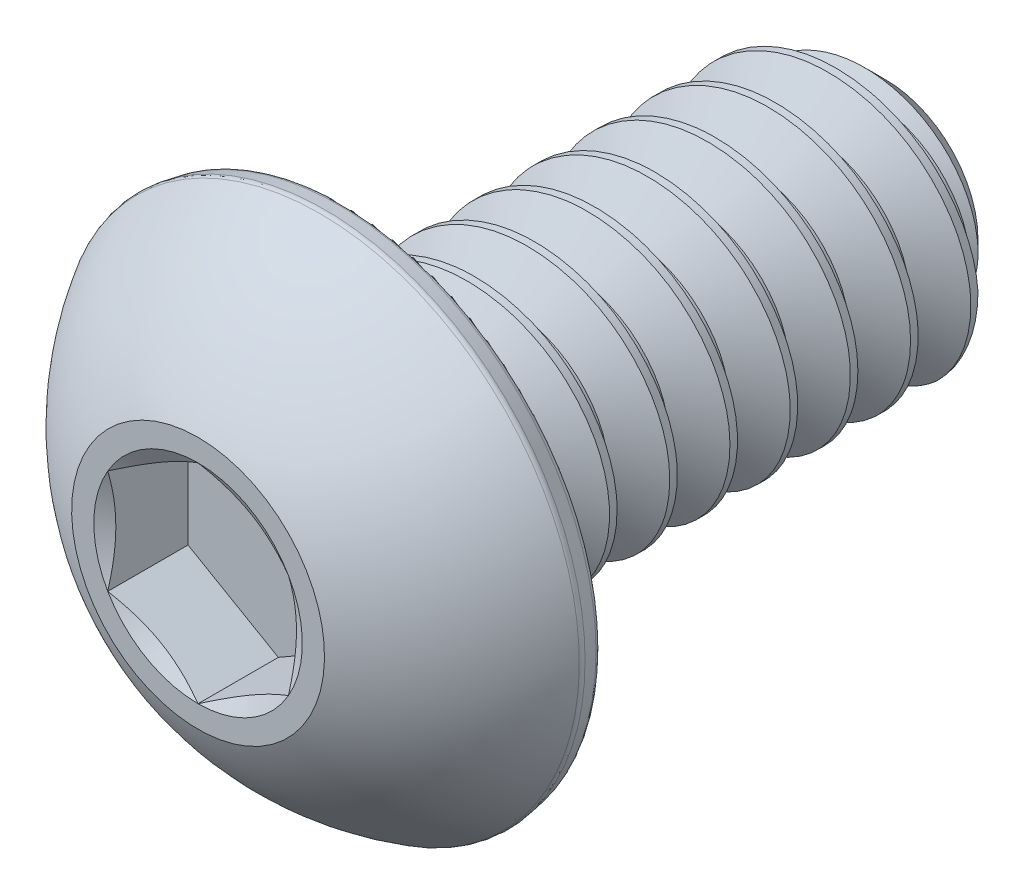
from build123d import *

# Parameters (mm, degrees)
CUT_EXTRUDE1_DEPTH = 1.41097
FILLET1_R          = 0.12827
CUT_SWEEP1_PITCH   = 1.058333333
CUT_SWEEP1_TO      = 9.525


with BuildPart() as part:
    # Sketch3 → Revolve1 (revolve)
    with BuildSketch(Plane(origin=(0, 0, 0), x_dir=(0, 0, -1), z_dir=(1, 0, 0)), mode=Mode.PRIVATE) as revolve1_sk:
        with BuildLine():
            Line((-6.0452, 0), (-6.0452, 2.2225))
            ThreePointArc((-6.0452, 2.2225), (-5.13946038, 3.573966445), (-3.86461, 4.5847))
            Line((-3.86461, 4.5847), (-3.4798, 4.516847615))
            Line((-3.4798, 4.516847615), (-3.4798, 2.413))
            Line((-3.4798, 2.413), (5.25145, 2.413))
            Line((5.25145, 2.413), (6.0452, 1.61925))
            Line((6.0452, 1.61925), (6.0452, 0))
            Line((6.0452, 0), (-6.0452, 0))
        make_face()
    revolve(revolve1_sk.sketch.rotate(Axis((0, 0, 6.0452), (0, 0, -1)), 90), axis=Axis((0, 0, 6.0452), (0, 0, -1)))

    # Sketch4 → Cut-Extrude1 (cut)
    with BuildSketch(Plane.XY.offset(6.0452)):
        Polygon((-1.5875, -0.916543552), (0, -1.833087105), (1.5875, -0.916543552), (1.5875, 0.916543552), (0, 1.833087105), (-1.5875, 0.916543552), align=None)
    extrude(amount=-CUT_EXTRUDE1_DEPTH, mode=Mode.SUBTRACT)

    # Cut-Extrude2 cone 1 section (through the dimple's axis) → Cut-Extrude2 (revolve, cut)
    with BuildSketch(Plane(origin=(0, 0, 6.0452), x_dir=(0, -1, 0), z_dir=(1, 0, 0))):
        Polygon((0, 0), (1.833087105, 0), (0, 1.058333333), align=None)
    revolve(axis=Axis((0, 0, 6.0452), (0, 0, -1)), mode=Mode.SUBTRACT)

    # Fillet1
    fillet1_edges = [part.edges().sort_by_distance(p)[0] for p in [
        (-4.516847615, 0, 3.4798),
        (-4.5847, 0, 3.86461),
    ]]
    fillet(fillet1_edges, radius=FILLET1_R)


with BuildPart() as body_2:
    # Split1: read off the stored shape, not the designer's step
    # Split1: the piece on the far side of the plane
    add(part.part)
    split(bisect_by=Plane.XY.offset(3.4798), keep=Keep.BOTTOM)

    # Cut-Sweep1: arcs per turn and ends read off the stored shape
    # Cut-Sweep1: the profile of Sketch7 screwed along a right-hand helix through 10 turns, 8 arcs to a turn; built about Z, then put on its axis
    cut_sweep1_z = Axis((0, 0, 0), (0, 0, 1))
    cut_sweep1_corners = [(2.470283972, 0, 0.033072917), (2.470283972, 0, -0.959114583), (1.725592336, 0, -0.529166667), (1.725592336, 0, -0.396875)]
    with BuildLine(mode=Mode.PRIVATE) as cut_sweep1_profile:
        Line(cut_sweep1_corners[0], cut_sweep1_corners[1])
        Line(cut_sweep1_corners[1], cut_sweep1_corners[2])
        Line(cut_sweep1_corners[2], cut_sweep1_corners[3])
        Line(cut_sweep1_corners[3], cut_sweep1_corners[0])
    cut_sweep1_cap = Face(cut_sweep1_profile.wire())
    cut_sweep1_turn_angles = [0, 22.5, 45, 67.5, 90, 112.5, 135, 157.5, 180, 202.5, 225, 247.5, 270, 292.5, 315, 337.5, 360]
    cut_sweep1_turn_weights = [1, 0.9238795325112867, 1, 0.9238795325112867, 1, 0.9238795325112867, 1, 0.9238795325112867, 1, 0.9238795325112867, 1, 0.9238795325112867, 1, 0.9238795325112867, 1, 0.9238795325112867, 1]
    cut_sweep1_turn_rails = [Edge.make_bspline([Vector(p[0], p[1], 0).rotate(cut_sweep1_z, cut_sweep1_turn_angles[k]) / cut_sweep1_turn_weights[k] + Vector(0, 0, p[2] + CUT_SWEEP1_PITCH * cut_sweep1_turn_angles[k] / 360) for k in range(17)], [0, 0, 0, 1, 1, 2, 2, 3, 3, 4, 4, 5, 5, 6, 6, 7, 7, 8, 8, 8], 2, cut_sweep1_turn_weights) for p in cut_sweep1_corners]
    cut_sweep1_turn_sides = [Face.make_surface_from_curves(cut_sweep1_turn_rails[p[0]], cut_sweep1_turn_rails[p[1]]) for p in [(0, 1), (1, 2), (2, 3), (3, 0)]]
    cut_sweep1 = Plane(origin=(0, 0, -6.0452), x_dir=(0, 1, 0), z_dir=(0, 0, 1)) * split(Solid(Shell([*[p.moved(Location((0, 0, CUT_SWEEP1_PITCH * i))) for i in range(10) for p in cut_sweep1_turn_sides], cut_sweep1_cap, cut_sweep1_cap.rotate(cut_sweep1_z, 3600).moved(Location((0, 0, CUT_SWEEP1_PITCH * 3600 / 360)))])), bisect_by=Plane.XY.offset(CUT_SWEEP1_TO), keep=Keep.BOTTOM, mode=Mode.PRIVATE)
    add(cut_sweep1, mode=Mode.SUBTRACT)


with BuildPart() as part_1:
    add(part.part)

    # Split1
    split(bisect_by=Plane.XY.offset(3.4798), keep=Keep.TOP)

    add(body_2.part)  # Boss-Extrude1 merges body 2
    # Boss-Extrude1: read off the stored shape, not the designer's step
    # Boss-Extrude1 outline → Boss-Extrude1 (revolve)
    with BuildSketch(Plane.XZ):
        Polygon((1.725588494, 3.4798), (1.725588494, 2.67782055), (2.527567944, 3.4798), align=None)
    revolve(axis=Axis((0, 0, 0), (0, 0, 1)))


solid = part_1.part
